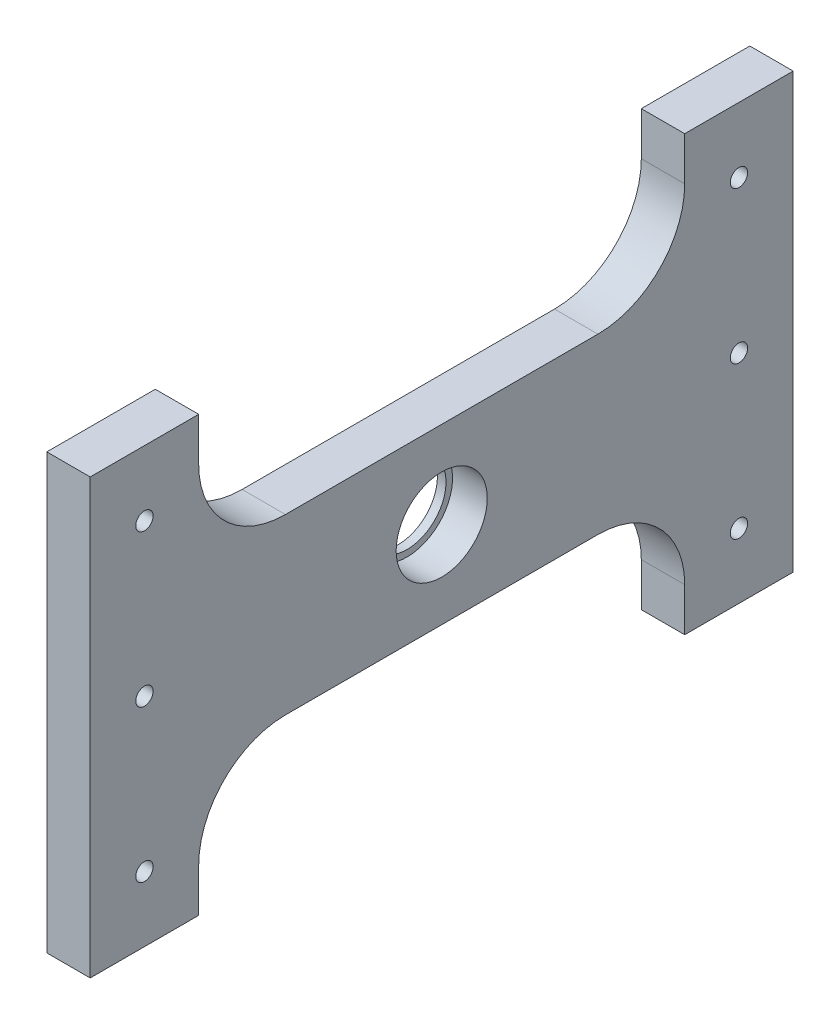
from build123d import *

# Parameters (mm, degrees)
SKETCH1_R           = 10.5
SKETCH1_R_2         = 2
BOSS_EXTRUDE1_DEPTH = 10
FILLET1_R           = 20
SKETCH2_R           = 10.5
SKETCH2_R_2         = 9
BOSS_EXTRUDE2_DEPTH = 2


with BuildPart() as part:
    # Sketch1 → Boss-Extrude1 (new body)
    with BuildSketch(Plane(origin=(0, 0, 0), x_dir=(0, 0, -1), z_dir=(1, 0, 0))):
        Polygon((56, 20), (-56, 20), (-56, 50), (-81, 50), (-81, -50), (-56, -50), (-56, -20), (56, -20), (56, -50), (81, -50), (81, 50), (56, 50), align=None)
        Circle(SKETCH1_R, mode=Mode.SUBTRACT)
        with Locations((-68.5, 35)):
            Circle(SKETCH1_R_2, mode=Mode.SUBTRACT)
        with Locations((-68.5, -35)):
            Circle(SKETCH1_R_2, mode=Mode.SUBTRACT)
        with Locations((-68.5, 0)):
            Circle(SKETCH1_R_2, mode=Mode.SUBTRACT)
        with Locations((68.5, 35)):
            Circle(SKETCH1_R_2, mode=Mode.SUBTRACT)
        with Locations((68.5, -35)):
            Circle(SKETCH1_R_2, mode=Mode.SUBTRACT)
        with Locations((68.5, 0)):
            Circle(SKETCH1_R_2, mode=Mode.SUBTRACT)
    extrude(amount=BOSS_EXTRUDE1_DEPTH)

    # Fillet1
    fillet1_edges = [part.edges().sort_by_distance(p)[0] for p in [
        (5, -20, -56),
        (5, 20, -56),
        (5, 20, 56),
        (5, -20, 56),
    ]]
    fillet(fillet1_edges, radius=FILLET1_R)

    # Sketch2 → Boss-Extrude2 (add)
    with BuildSketch(Plane.ZY):
        Circle(SKETCH2_R)
        Circle(SKETCH2_R_2, mode=Mode.SUBTRACT)
    extrude(amount=-BOSS_EXTRUDE2_DEPTH)


solid = part.part
